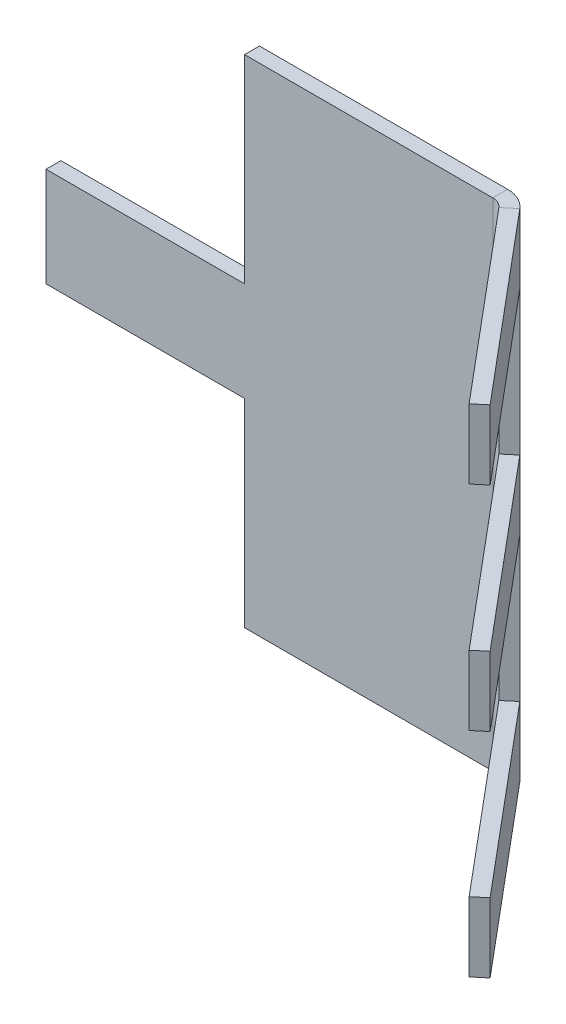
from build123d import *

# Parameters (mm, degrees)
SKETCH1_W          = 50
SKETCH1_H          = 100
BASE_FLANGE1_DEPTH = 3
EDGE_FLANGE2_DEPTH = 100
SKETCH12_W         = 48.601077025
SKETCH12_H         = 29
CUT_EXTRUDE1_DEPTH = 29
SKETCH13_W         = 48.601077025
SKETCH13_H         = 29
CUT_EXTRUDE2_DEPTH = 29
SKETCH14_W         = 80
SKETCH14_H         = 20
TAB1_DEPTH         = 3


# Sheet-metal steps are written as plain solids
with BuildPart() as part:
    # Sketch1 → Base-Flange1 (new body)
    with BuildSketch(Plane.XY):
        with Locations((-11.571125265, -23.036093418)):
            Rectangle(SKETCH1_W, SKETCH1_H)
    extrude(amount=-BASE_FLANGE1_DEPTH)

    # Edge-Flange2 section (across the edge) → Edge-Flange2 (add)
    with BuildSketch(Plane(origin=(14.827797709, -73.036093418, 0), x_dir=(-0.7660444431189746, 0, 0.6427876096865435), z_dir=(0, 1, 0))):
        with BuildLine():
            Line((-3, 1.398922974), (-3, 50))
            Line((-3, 50), (0, 50))
            Line((0, 50), (0, 1.398922974))
            ThreePointArc((0, 1.398922974), (0.281076639, 0.131068189), (1.071637171, -0.899210355))
            Line((1.071637171, -0.899210355), (-0.856725658, -3.197343684))
            ThreePointArc((-0.856725658, -3.197343684), (-2.437846722, -1.136786596), (-3, 1.398922974))
        make_face()
    extrude(amount=EDGE_FLANGE2_DEPTH)

    # Sketch12 → Cut-Extrude1 (cut)
    with BuildSketch(Plane(origin=(8.70130888, 0, -7.301265072), x_dir=(0.6427876096865439, 0, 0.7660444431189742), z_dir=(-0.7660444431189742, 0, 0.6427876096865439))):
        with Locations((35.230586133, -1.536093418)):
            Rectangle(SKETCH12_W, SKETCH12_H)
    extrude(amount=-CUT_EXTRUDE1_DEPTH, mode=Mode.SUBTRACT)

    # Sketch13 → Cut-Extrude2 (cut)
    with BuildSketch(Plane(origin=(8.70130888, 0, -7.301265072), x_dir=(0.6427876096865439, 0, 0.7660444431189742), z_dir=(-0.7660444431189742, 0, 0.6427876096865439))):
        with Locations((35.230586133, -44.536093418)):
            Rectangle(SKETCH13_W, SKETCH13_H)
    extrude(amount=-CUT_EXTRUDE2_DEPTH, mode=Mode.SUBTRACT)

    # Sketch14 → Tab1 (add)
    with BuildSketch(Plane.XY):
        with Locations((-36.571125265, -23.036093418)):
            Rectangle(SKETCH14_W, SKETCH14_H)
    extrude(amount=-TAB1_DEPTH)


solid = part.part
